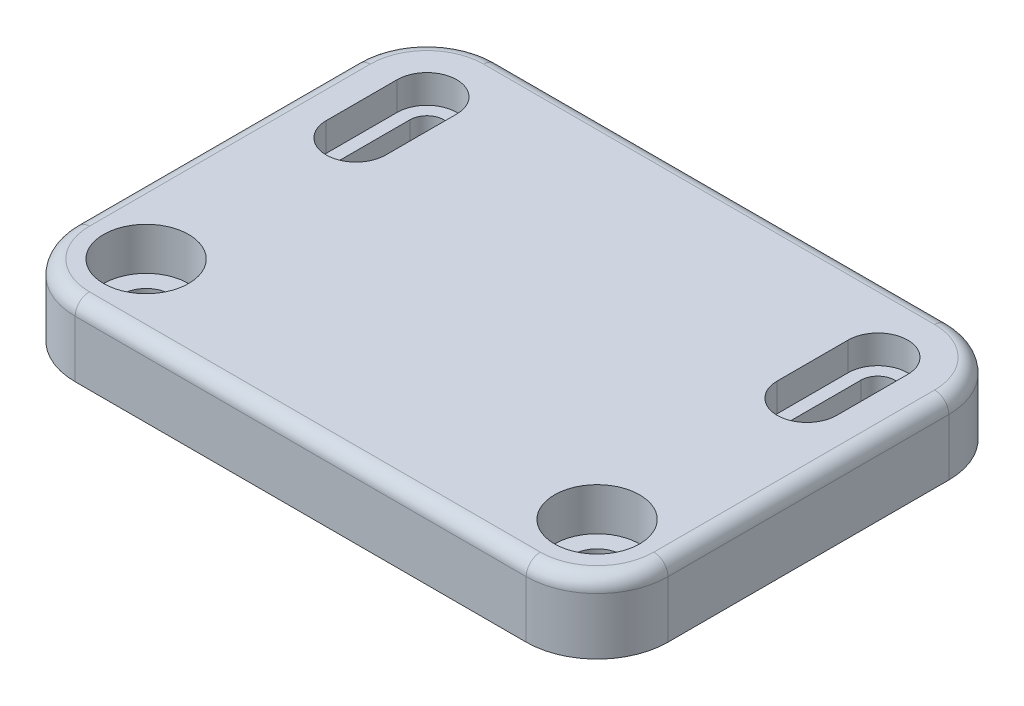
from build123d import *

# Parameters (mm, degrees)
SKETCH1_W           = 41.8
SKETCH1_H           = 29.8
SKETCH1_R           = 1.7
BOSS_EXTRUDE1_DEPTH = 5
FILLET1_R           = 5
FILLET2_R           = 1
CUT_EXTRUDE1_START  = -3
SKETCH2_R           = 3
SKETCH2_R_2         = 1.7
CUT_EXTRUDE1_DEPTH  = 3
CUT_EXTRUDE2_START  = -2
CUT_EXTRUDE2_DEPTH  = 2


with BuildPart() as part:
    # Sketch1 → Boss-Extrude1 (new body)
    with BuildSketch(Plane(origin=(0, 0, 0), x_dir=(1, 0, 0), z_dir=(0, 1, 0))):
        with Locations((20.9, 14.9)):
            Rectangle(SKETCH1_W, SKETCH1_H)
        with Locations((5, 5)):
            Circle(SKETCH1_R, mode=Mode.SUBTRACT)
        with Locations((36.8, 5)):
            Circle(SKETCH1_R, mode=Mode.SUBTRACT)
        with BuildLine():
            Line((3.8, 19.8), (3.8, 24.8))
            ThreePointArc((3.8, 24.8), (5, 26), (6.2, 24.8))
            Line((6.2, 24.8), (6.2, 19.8))
            ThreePointArc((6.2, 19.8), (5, 18.6), (3.8, 19.8))
        make_face(mode=Mode.SUBTRACT)
        with BuildLine():
            Line((35.6, 19.8), (35.6, 24.8))
            ThreePointArc((35.6, 24.8), (36.8, 26), (38, 24.8))
            Line((38, 24.8), (38, 19.8))
            ThreePointArc((38, 19.8), (36.8, 18.6), (35.6, 19.8))
        make_face(mode=Mode.SUBTRACT)
    extrude(amount=BOSS_EXTRUDE1_DEPTH)

    # Fillet1
    fillet1_edges = [part.edges().sort_by_distance(p)[0] for p in [
        (0, 2.5, -29.8),
        (41.8, 2.5, -29.8),
        (41.8, 2.5, 0),
        (0, 2.5, 0),
    ]]
    fillet(fillet1_edges, radius=FILLET1_R)

    # Fillet2
    fillet2_edges = [part.edges().sort_by_distance(p)[0] for p in [
        (1.464466094, 5, -1.464466094),
        (0, 5, -14.9),
        (1.464466094, 5, -28.335533906),
        (20.9, 5, -29.8),
        (40.335533906, 5, -28.335533906),
        (41.8, 5, -14.9),
        (40.335533906, 5, -1.464466094),
        (20.9, 5, 0),
    ]]
    fillet(fillet2_edges, radius=FILLET2_R)

    # Sketch2 → Cut-Extrude1 (cut)
    # profile 1 of 2: a face of its own
    with BuildSketch(Plane(origin=(0, 5, 0), x_dir=(1, 0, 0), z_dir=(0, 1, 0)).offset(CUT_EXTRUDE1_START)):
        with Locations((5, 5)):
            Circle(SKETCH2_R)
        with Locations((5, 5)):
            Circle(SKETCH2_R_2, mode=Mode.SUBTRACT)
    # profile 2 of 2: a face of its own
    with BuildSketch(Plane(origin=(0, 5, 0), x_dir=(1, 0, 0), z_dir=(0, 1, 0)).offset(CUT_EXTRUDE1_START)):
        with Locations((36.8, 5)):
            Circle(SKETCH2_R)
        with Locations((36.8, 5)):
            Circle(SKETCH2_R_2, mode=Mode.SUBTRACT)
    extrude(amount=CUT_EXTRUDE1_DEPTH, mode=Mode.SUBTRACT)

    # Sketch2<3> → Cut-Extrude2 (cut)
    # profile 1 of 2: a face of its own
    with BuildSketch(Plane(origin=(0, 5, 0), x_dir=(1, 0, 0), z_dir=(0, 1, 0)).offset(CUT_EXTRUDE2_START)):
        with BuildLine():
            Line((7.1, 19.8), (7.1, 24.8))
            ThreePointArc((7.1, 24.8), (5, 26.9), (2.9, 24.8))
            Line((2.9, 24.8), (2.9, 19.8))
            ThreePointArc((2.9, 19.8), (5, 17.7), (7.1, 19.8))
        make_face()
        with BuildLine():
            Line((6.2, 24.8), (6.2, 19.8))
            ThreePointArc((6.2, 19.8), (5, 18.6), (3.8, 19.8))
            Line((3.8, 19.8), (3.8, 24.8))
            ThreePointArc((3.8, 24.8), (5, 26), (6.2, 24.8))
        make_face(mode=Mode.SUBTRACT)
    # profile 2 of 2: a face of its own
    with BuildSketch(Plane(origin=(0, 5, 0), x_dir=(1, 0, 0), z_dir=(0, 1, 0)).offset(CUT_EXTRUDE2_START)):
        with BuildLine():
            Line((38.9, 19.8), (38.9, 24.8))
            ThreePointArc((38.9, 24.8), (36.8, 26.9), (34.7, 24.8))
            Line((34.7, 24.8), (34.7, 19.8))
            ThreePointArc((34.7, 19.8), (36.8, 17.7), (38.9, 19.8))
        make_face()
        with BuildLine():
            Line((38, 24.8), (38, 19.8))
            ThreePointArc((38, 19.8), (36.8, 18.6), (35.6, 19.8))
            Line((35.6, 19.8), (35.6, 24.8))
            ThreePointArc((35.6, 24.8), (36.8, 26), (38, 24.8))
        make_face(mode=Mode.SUBTRACT)
    extrude(amount=CUT_EXTRUDE2_DEPTH, mode=Mode.SUBTRACT)


solid = part.part
